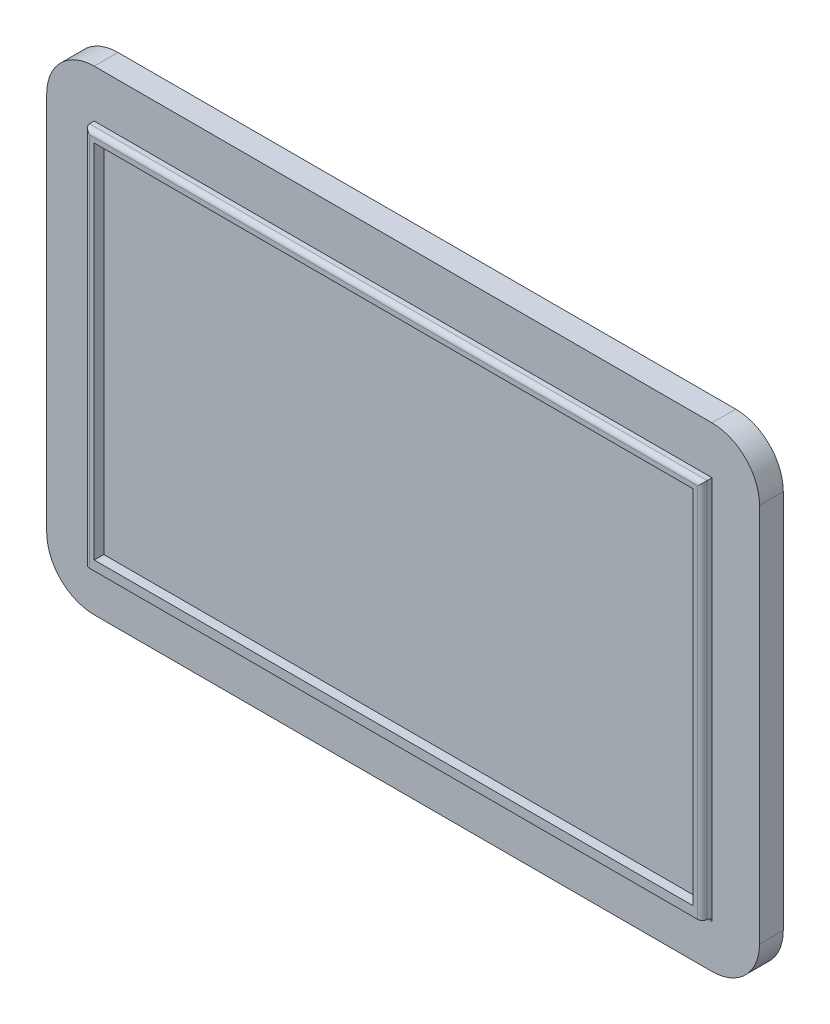
from build123d import *

# Parameters (mm, degrees)
BOSS_EXTRUDE1_DEPTH = 5
SKETCH2_W           = 130
SKETCH2_H           = 80
SKETCH2_W_2         = 126
SKETCH2_H_2         = 76
BOSS_EXTRUDE2_DEPTH = 2
FILLET1_R           = 1
SKETCH3_R           = 2.5
CUT_EXTRUDE1_DEPTH  = 3


with BuildPart() as part:
    # Sketch1 → Boss-Extrude1 (new body)
    with BuildSketch(Plane.XY):
        with BuildLine():
            Line((65, 50), (-65, 50))
            ThreePointArc((-65, 50), (-72.071067812, 47.071067812), (-75, 40))
            Line((-75, 40), (-75, -40))
            ThreePointArc((-75, -40), (-72.071067812, -47.071067812), (-65, -50))
            Line((-65, -50), (65, -50))
            ThreePointArc((65, -50), (72.071067812, -47.071067812), (75, -40))
            Line((75, -40), (75, 40))
            ThreePointArc((75, 40), (72.071067812, 47.071067812), (65, 50))
        make_face()
    extrude(amount=-BOSS_EXTRUDE1_DEPTH)

    # Sketch2 → Boss-Extrude2 (add)
    with BuildSketch(Plane.XY):
        Rectangle(SKETCH2_W, SKETCH2_H)
        Rectangle(SKETCH2_W_2, SKETCH2_H_2, mode=Mode.SUBTRACT)
    extrude(amount=BOSS_EXTRUDE2_DEPTH)

    # Fillet1
    fillet1_edges = [part.edges().sort_by_distance(p)[0] for p in [
        (0, -40, 0),
        (65, 0, 2),
        (-65, 0, 2),
        (0, 40, 2),
    ]]
    fillet(fillet1_edges, radius=FILLET1_R - 0.0001)  # a hair under: the kernel refuses the full size

    # Sketch3 → Cut-Extrude1 (cut)
    with BuildSketch(Plane(origin=(0, 0, -5), x_dir=(-1, 0, 0), z_dir=(0, 0, -1))):
        with Locations((-30, 0)):
            Circle(SKETCH3_R)
        with Locations((30, 0)):
            Circle(SKETCH3_R)
    extrude(amount=-CUT_EXTRUDE1_DEPTH, mode=Mode.SUBTRACT)


solid = part.part
